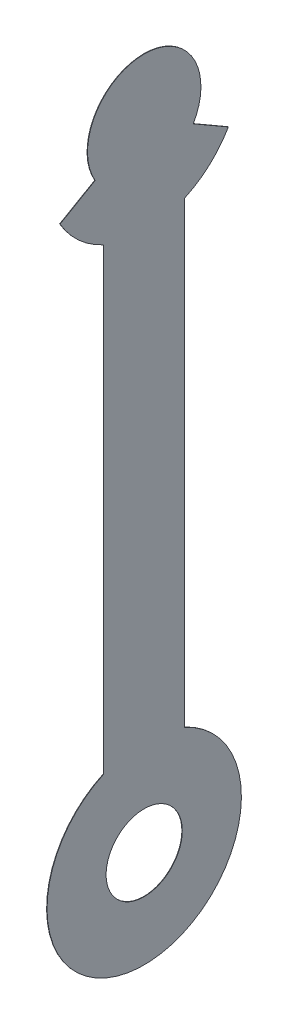
from build123d import *

# Parameters (mm, degrees)
SKETCH1_R           = 23.5
BOSS_EXTRUDE1_DEPTH = 0.25


with BuildPart() as part:
    # Sketch1 → Boss-Extrude1 (new body)
    with BuildSketch(Plane(origin=(0, 0, 0), x_dir=(0, 0, -1), z_dir=(1, 0, 0))):
        with BuildLine():
            Line((51.961524227, -30), (30.310889132, -17.5))
            ThreePointArc((30.310889132, -17.5), (0, 35), (-30.310889132, -17.5))
            Line((-30.310889132, -17.5), (-51.961524227, -30))
            ThreePointArc((-51.961524227, -30), (-40.390167668, -44.369295191), (-25, -54.543560573))
            Line((-25, -54.543560573), (-25, -337.456439427))
            ThreePointArc((-25, -337.456439427), (0, -452), (25, -337.456439427))
            Line((25, -337.456439427), (25, -54.543560573))
            ThreePointArc((25, -54.543560573), (40.390167668, -44.369295191), (51.961524227, -30))
        make_face()
        with Locations((0, -392)):
            Circle(SKETCH1_R, mode=Mode.SUBTRACT)
    extrude(amount=-BOSS_EXTRUDE1_DEPTH)


solid = part.part
